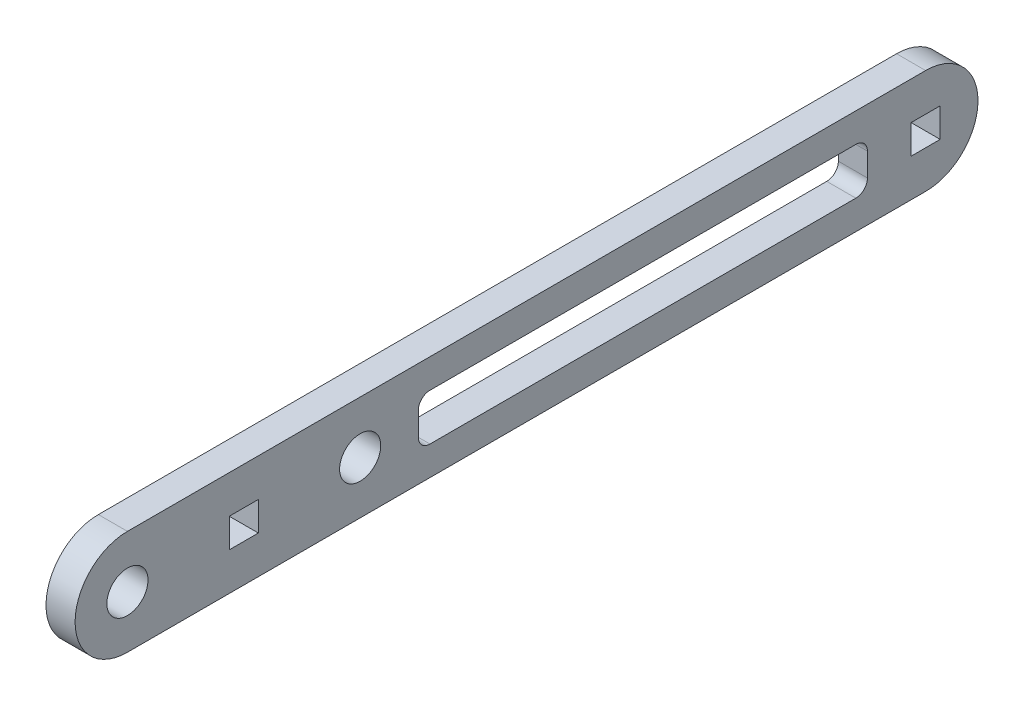
from build123d import *

# Parameters (mm, degrees)
SKETCH1_R           = 2.24506403
SKETCH1_W           = 3.175
SKETCH1_H           = 3.175
BOSS_EXTRUDE1_DEPTH = 3.175


with BuildPart() as part:
    # Sketch1 → Boss-Extrude1 (new body)
    with BuildSketch(Plane(origin=(0, 0, 0), x_dir=(0, 0, -1), z_dir=(1, 0, 0))):
        with BuildLine():
            Line((-87.122, 5.715), (0, 5.715))
            ThreePointArc((0, 5.715), (5.715, 0), (0, -5.715))
            Line((0, -5.715), (-87.122, -5.715))
            ThreePointArc((-87.122, -5.715), (-92.837, 0), (-87.122, 5.715))
        make_face()
        with Locations((-61.722, 0)):
            Circle(SKETCH1_R, mode=Mode.SUBTRACT)
        with Locations((-87.122, 0)):
            Circle(SKETCH1_R, mode=Mode.SUBTRACT)
        with Locations((-74.422, 0)):
            Rectangle(SKETCH1_W, SKETCH1_H, mode=Mode.SUBTRACT)
        with BuildLine():
            Line((-55.372, 0), (-55.372, 1.27))
            ThreePointArc((-55.372, 1.27), (-55.000025612, 2.168025612), (-54.102, 2.54))
            Line((-54.102, 2.54), (-7.62, 2.54))
            ThreePointArc((-7.62, 2.54), (-6.721974388, 2.168025612), (-6.35, 1.27))
            Line((-6.35, 1.27), (-6.35, -1.27))
            ThreePointArc((-6.35, -1.27), (-6.721974388, -2.168025612), (-7.62, -2.54))
            Line((-7.62, -2.54), (-54.102, -2.54))
            ThreePointArc((-54.102, -2.54), (-55.000025612, -2.168025612), (-55.372, -1.27))
            Line((-55.372, -1.27), (-55.372, 0))
        make_face(mode=Mode.SUBTRACT)
        Rectangle(SKETCH1_W, SKETCH1_H, mode=Mode.SUBTRACT)
    extrude(amount=BOSS_EXTRUDE1_DEPTH)


solid = part.part
